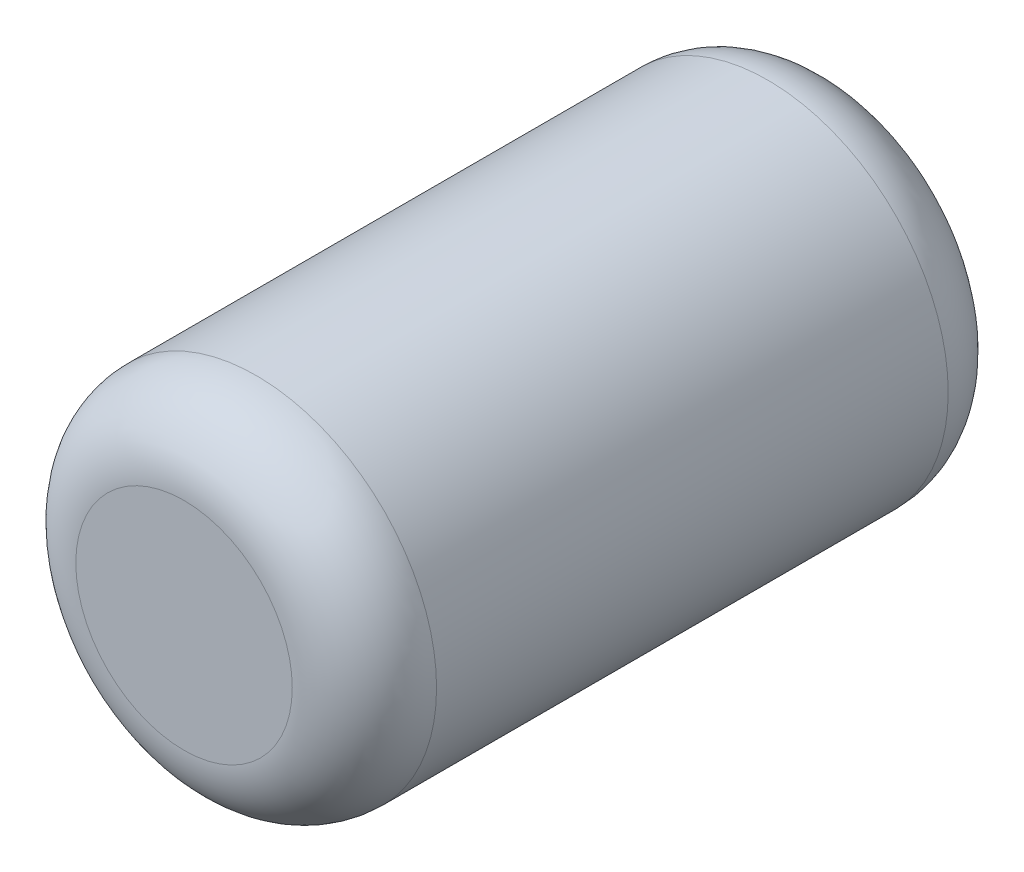
from build123d import *

# Parameters (mm, degrees)
SKETCH1_R           = 34.925
BOSS_EXTRUDE1_DEPTH = 127
FILLET1_R           = 13.97


with BuildPart() as part:
    # Sketch1 → Boss-Extrude1 (new body)
    with BuildSketch(Plane.XY):
        Circle(SKETCH1_R)
    extrude(amount=BOSS_EXTRUDE1_DEPTH)

    # Fillet1
    fillet1_edges = [part.edges().sort_by_distance(p)[0] for p in [
        (-34.925, 0, 127),
        (-34.925, 0, 0),
    ]]
    fillet(fillet1_edges, radius=FILLET1_R)


solid = part.part
